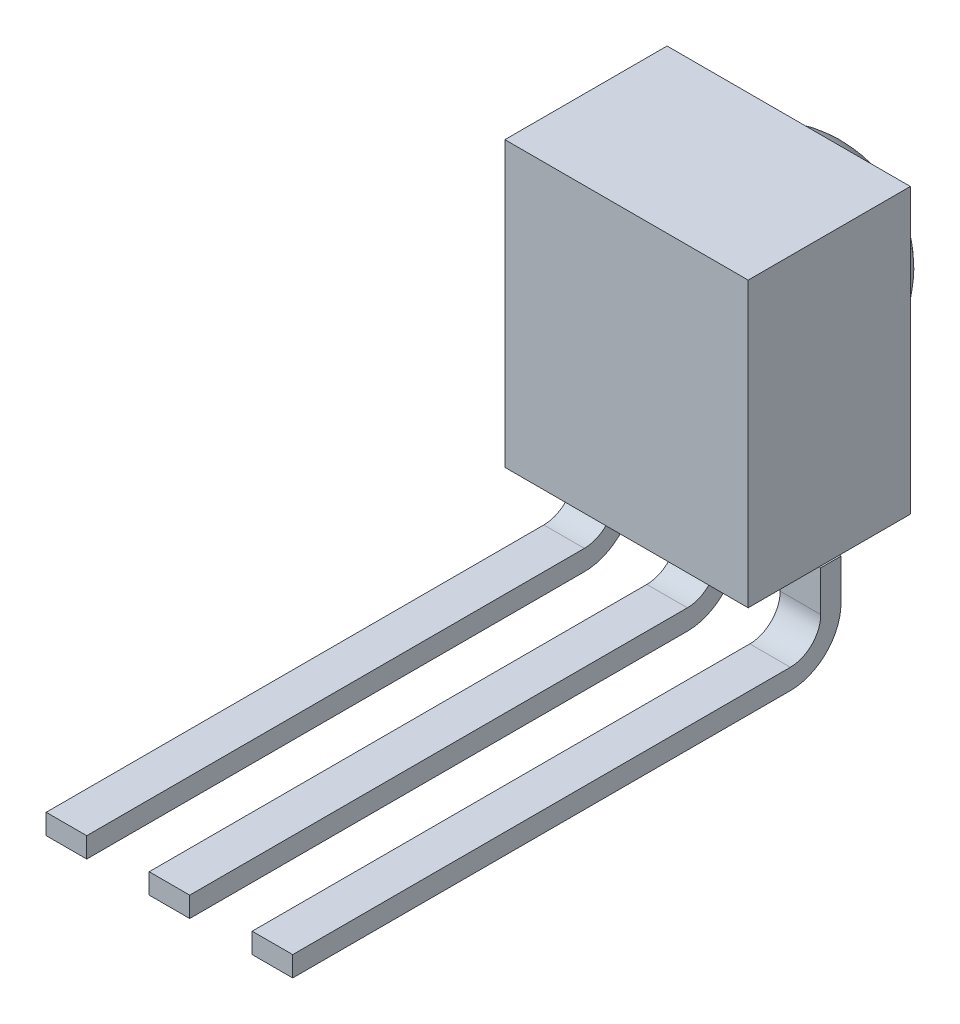
from build123d import *

# Parameters (mm, degrees)
SKETCH_1_W      = 6
SKETCH_1_H      = 4
EXTRUDE_1_DEPTH = 7
SKETCH_2_R      = 2.5
EXTRUDE_2_DEPTH = 2
FILLET_1_R      = 2.5
SKETCH_3_W      = 1
SKETCH_3_H      = 0.5


with BuildPart() as part:
    # 草图1 → 拉伸1 (new body)
    with BuildSketch(Plane(origin=(0, 0, 0), x_dir=(1, 0, 0), z_dir=(0, 1, 0))):
        Rectangle(SKETCH_1_W, SKETCH_1_H)
    extrude(amount=EXTRUDE_1_DEPTH)

    # 草图2 → 拉伸2 (add)
    with BuildSketch(Plane(origin=(0, 0, -2), x_dir=(-1, 0, 0), z_dir=(0, 0, -1))):
        with Locations(Location((0, 4.040945029, 0), (0, 0, 180))):
            Circle(SKETCH_2_R)
    extrude(amount=EXTRUDE_2_DEPTH)

    # 圆角1
    # the kernel refuses this fillet: 2.5 mm, written as the material it takes off along each edge
    with BuildSketch(Plane(origin=(0, 4.040945029, -4), x_dir=(1, 0, 0), z_dir=(0, 1, 0))) as fillet_1_piece_1:
        with BuildLine():
            CenterArc((0.050510257, -2.5), FILLET_1_R, 11.536959033, 78.463040967)
            Line((0.050510257, 0), (0.050510257, 0.05))
            Line((0.050510257, 0.05), (2.5, 0.05))
            Line((2.5, 0.05), (2.55, 0))
            ThreePointArc((2.55, 0), (2.55, -1), (2.548989795, -1.99))
            Line((2.548989795, -1.99), (2.5, -2))
        make_face()
    revolve(axis=Axis((0, 4.040945029, -4), (0, 0, -1)), mode=Mode.SUBTRACT)

    # 扫描1: sweep along a path in 草图4
    with BuildLine(Plane(origin=(0, 0, 0), x_dir=(0, 0, -1), z_dir=(1, 0, 0))) as sweep_1_path:
        Line((0, 0), (0, -1))
        ThreePointArc((0, -1), (-0.292893219, -1.707106781), (-1, -2))
        Line((-1, -2), (-13.273282855, -2))
    # 草图3 → 扫描1 (sweep)
    with BuildSketch(Plane.XZ):
        Rectangle(SKETCH_3_W, SKETCH_3_H)
        with Locations((2.54, 0)):
            Rectangle(SKETCH_3_W, SKETCH_3_H)
        with Locations((-2.54, 0)):
            Rectangle(SKETCH_3_W, SKETCH_3_H)
    sweep(path=sweep_1_path.line)


solid = part.part
